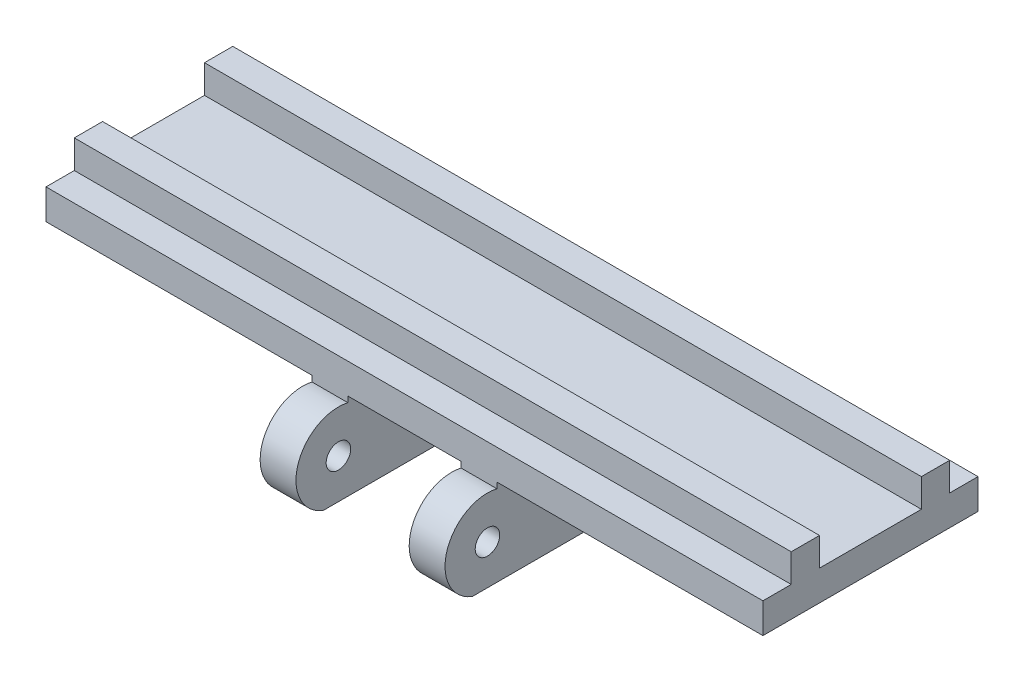
from build123d import *

# Parameters (mm, degrees)
SKETCH_1_W                = 38
SKETCH_1_H                = 11.4
EXTRUDE_1_DEPTH           = 1.6
SKETCH_1_4_W              = 4
SKETCH_1_4_H              = 14
EXTRUDE_2_DEPTH           = 5
SKETCH_2_W                = 0.1
SKETCH_2_H                = 1.3
SKETCH_2_W_2              = 10
SKETCH_2_W_3              = 2
CUT_EXTRUDE_1_DEPTH       = 21.856653615
CUT_EXTRUDE_START         = 7
CUT_EXTRUDE_2_DEPTH       = 2.1
CUT_EXTRUDE_START_2       = -4.9
CUT_EXTRUDE_3_DEPTH       = 2.1
CUT_EXTRUDE_6_DEPTH       = 21.856653615
CUT_EXTRUDE_6_DEPTH_BACK  = 21.856653615
EXTRUDE_START             = 5.1
SKETCH_4_6_R              = 2.25
EXTRUDE_3_DEPTH           = 1.9
EXTRUDE_START_2           = -7
SKETCH_4_7_R              = 2.25
EXTRUDE_4_DEPTH           = 1.9
CUT_EXTRUDE_7_DEPTH       = 22.386970332
CUT_EXTRUDE_7_DEPTH_BACK  = 22.386970332
SKETCH_3_R                = 0.65
SKETCH_3_R_2              = 0.55
CUT_EXTRUDE_START_3       = 3
CUT_EXTRUDE_8_DEPTH       = 2.1
CUT_EXTRUDE_START_4       = -5.1
SKETCH_5_2_R              = 2.5
SKETCH_5_2_W              = 2.5
SKETCH_5_2_H              = 2.5
CUT_EXTRUDE_9_DEPTH       = 5.1
CUT_EXTRUDE_10_DEPTH      = 22.386970332
CUT_EXTRUDE_10_DEPTH_BACK = 22.386970332
EXTRUDE_START_3           = 3
EXTRUDE_5_DEPTH           = 1.9
EXTRUDE_START_4           = -4.9
EXTRUDE_6_DEPTH           = 1.9
CUT_EXTRUDE_11_DEPTH      = 22.386970332
CUT_EXTRUDE_11_DEPTH_BACK = 22.386970332
SKETCH_3_3_R              = 0.65
SKETCH_3_3_R_2            = 0.55
CUT_EXTRUDE_12_DEPTH      = 22.386970332
CUT_EXTRUDE_12_DEPTH_BACK = 22.386970332
SKETCH_9_W                = 15.45
SKETCH_9_H                = 0.397025916
SKETCH_10_W               = 38
SKETCH_10_H               = 1.5
EXTRUDE_7_DEPTH           = 1.5
FILLET_1_R                = 1
SKETCH_11_W               = 4.7
SKETCH_11_H               = 4.602974084
CUT_EXTRUDE_13_DEPTH      = 17.397649411
CUT_EXTRUDE_START_5       = 4.9
SKETCH_11_2_W             = 4.7
SKETCH_11_2_H             = 4.602974084
CUT_EXTRUDE_14_DEPTH      = 17.397649411
CUT_EXTRUDE_START_6       = 5.1
SKETCH_11_4_W             = 4.7
SKETCH_11_4_H             = 4.602974084
CUT_EXTRUDE_15_DEPTH      = 10.2


# Read off the part's stored shape, not the designer's step: 切除-拉伸8, 凸台-拉伸5, 凸台-拉伸6
with BuildPart() as part:
    # 草图1 → 凸台-拉伸1 (new body)
    with BuildSketch(Plane(origin=(0, 0, 0), x_dir=(1, 0, 0), z_dir=(0, 1, 0))):
        Rectangle(SKETCH_1_W, SKETCH_1_H)
    extrude(amount=EXTRUDE_1_DEPTH)

    # 草图1<4> → 凸台-拉伸2 (add)
    with BuildSketch(Plane(origin=(0, 0, 0), x_dir=(1, 0, 0), z_dir=(0, 1, 0))):
        with Locations((-5, 0)):
            Rectangle(SKETCH_1_4_W, SKETCH_1_4_H)
        with Locations((5, 0)):
            Rectangle(SKETCH_1_4_W, SKETCH_1_4_H)
    extrude(amount=-EXTRUDE_2_DEPTH)

    # 草图2 → 切除-拉伸1 (cut, through all)
    with BuildSketch(Plane(origin=(0, 0, 0), x_dir=(1, 0, 0), z_dir=(0, 1, 0))):
        with Locations((-5.05, 6.35)):
            Rectangle(SKETCH_2_W, SKETCH_2_H)
        with Locations((0, 6.35)):
            Rectangle(SKETCH_2_W_2, SKETCH_2_H)
        with Locations((5.05, 6.35)):
            Rectangle(SKETCH_2_W, SKETCH_2_H)
        with Locations((-6, -6.35)):
            Rectangle(SKETCH_2_W_3, SKETCH_2_H)
        with Locations((-4.95, -6.35)):
            Rectangle(SKETCH_2_W, SKETCH_2_H)
        with Locations((4.95, -6.35)):
            Rectangle(SKETCH_2_W, SKETCH_2_H)
        with Locations((6, -6.35)):
            Rectangle(SKETCH_2_W_3, SKETCH_2_H)
    extrude(amount=-CUT_EXTRUDE_1_DEPTH, mode=Mode.SUBTRACT)

    # 草图4 → 切除-拉伸2 (cut)
    with BuildSketch(Plane(origin=(0, 0, 0), x_dir=(0, 0, -1), z_dir=(1, 0, 0)).offset(CUT_EXTRUDE_START)):
        with BuildLine():
            ThreePointArc((-3.7, -2.5), (-4.263508327, -0.91886117), (-5.7, -0.050510257))
            Line((-5.7, -0.050510257), (-5.7, -5))
            Line((-5.7, -5), (-3.7, -5))
            Line((-3.7, -5), (-3.7, -2.5))
        make_face()
    extrude(amount=-CUT_EXTRUDE_2_DEPTH, mode=Mode.SUBTRACT)

    # 草图4<3> → 切除-拉伸3 (cut)
    with BuildSketch(Plane(origin=(0, 0, 0), x_dir=(0, 0, -1), z_dir=(1, 0, 0)).offset(CUT_EXTRUDE_START_2)):
        with BuildLine():
            ThreePointArc((-3.7, -2.5), (-4.263508327, -0.91886117), (-5.7, -0.050510257))
            Line((-5.7, -0.050510257), (-5.7, -5))
            Line((-5.7, -5), (-3.7, -5))
            Line((-3.7, -5), (-3.7, -2.5))
        make_face()
    extrude(amount=-CUT_EXTRUDE_3_DEPTH, mode=Mode.SUBTRACT)

    # 草图4<5> → 切除-拉伸6 (cut, two sides: drawn at the far end of the back side and taken through both)
    with BuildSketch(Plane(origin=(0, 0, 0), x_dir=(0, 0, -1), z_dir=(1, 0, 0)).offset(-CUT_EXTRUDE_6_DEPTH_BACK)):
        with BuildLine():
            Line((8.45, 0), (5.7, 0))
            Line((5.7, 0), (5.7, -0.306258903))
            ThreePointArc((5.7, -0.306258903), (7.60312152, -0.74109409), (8.45, -2.5))
            Line((8.45, -2.5), (8.45, 0))
        make_face()
        with BuildLine():
            Line((8.45, -5), (8.45, -2.5))
            ThreePointArc((8.45, -2.5), (7.60312152, -4.25890591), (5.7, -4.693741097))
            Line((5.7, -4.693741097), (5.7, -5))
            Line((5.7, -5), (8.45, -5))
        make_face()
    extrude(amount=CUT_EXTRUDE_6_DEPTH + CUT_EXTRUDE_6_DEPTH_BACK, mode=Mode.SUBTRACT)

    # 草图4<6> → 凸台-拉伸3 (add)
    with BuildSketch(Plane(origin=(0, 0, 0), x_dir=(0, 0, -1), z_dir=(1, 0, 0)).offset(EXTRUDE_START)):
        with Locations((6.2, -2.5)):
            Circle(SKETCH_4_6_R)
    extrude(amount=EXTRUDE_3_DEPTH)

    # 草图4<7> → 凸台-拉伸4 (add)
    with BuildSketch(Plane(origin=(0, 0, 0), x_dir=(0, 0, -1), z_dir=(1, 0, 0)).offset(EXTRUDE_START_2)):
        with Locations((6.2, -2.5)):
            Circle(SKETCH_4_7_R)
    extrude(amount=EXTRUDE_4_DEPTH)

    # 草图3 → 切除-拉伸7 (cut, two sides: drawn at the far end of the back side and taken through both)
    with BuildSketch(Plane(origin=(0, 0, 0), x_dir=(0, 0, -1), z_dir=(1, 0, 0)).offset(-CUT_EXTRUDE_7_DEPTH_BACK)):
        with Locations(Location((-6.2, -2.5, 0), (0, 0, 180))):
            Circle(SKETCH_3_R)
        with Locations(Location((6.2, -2.5, 0), (0, 0, 204.619977329))):
            Circle(SKETCH_3_R_2)
    extrude(amount=CUT_EXTRUDE_7_DEPTH + CUT_EXTRUDE_7_DEPTH_BACK, mode=Mode.SUBTRACT)

    # 切除-拉伸8 outline → 切除-拉伸8 (cut)
    with BuildSketch(Plane(origin=(0, 0, 0), x_dir=(0, 0, -1), z_dir=(1, 0, 0)).offset(CUT_EXTRUDE_START_3)):
        with BuildLine():
            Line((3.7, -2.5), (3.7, -5))
            Line((3.7, -5), (5.7, -5))
            Line((5.7, -5), (5.7, -2.729128785))
            ThreePointArc((5.7, -2.729128785), (5.65, -2.5), (5.7, -2.270871215))
            Line((5.7, -2.270871215), (5.7, -0.050510257))
            ThreePointArc((5.7, -0.050510257), (4.263508327, -0.91886117), (3.7, -2.5))
        make_face()
    extrude(amount=CUT_EXTRUDE_8_DEPTH, mode=Mode.SUBTRACT)

    # 草图5<2> → 切除-拉伸9 (cut)
    with BuildSketch(Plane(origin=(0, 0, 0), x_dir=(0, 0, -1), z_dir=(1, 0, 0)).offset(CUT_EXTRUDE_START_4)):
        with Locations((6.2, -2.5)):
            Circle(SKETCH_5_2_R)
        with Locations((4.95, -3.75)):
            Rectangle(SKETCH_5_2_W, SKETCH_5_2_H)
    extrude(amount=CUT_EXTRUDE_9_DEPTH, mode=Mode.SUBTRACT)

    # 草图7 → 切除-拉伸10 (cut, two sides: drawn at the far end of the back side and taken through both)
    with BuildSketch(Plane(origin=(0, 0, 0), x_dir=(0, 0, -1), z_dir=(1, 0, 0)).offset(-CUT_EXTRUDE_10_DEPTH_BACK)):
        with BuildLine():
            Line((-5.7, -0.306258903), (-5.7, 0))
            Line((-5.7, 0), (-8.45, 0))
            Line((-8.45, 0), (-8.45, -2.5))
            ThreePointArc((-8.45, -2.5), (-7.60312152, -0.74109409), (-5.7, -0.306258903))
        make_face()
    extrude(amount=CUT_EXTRUDE_10_DEPTH + CUT_EXTRUDE_10_DEPTH_BACK, mode=Mode.SUBTRACT)

    # 凸台-拉伸5 outline → 凸台-拉伸5 (add)
    with BuildSketch(Plane(origin=(0, 0, 0), x_dir=(0, 0, -1), z_dir=(1, 0, 0)).offset(EXTRUDE_START_3)):
        with BuildLine():
            Line((-7, -4.602974084), (-7, -0.397025915))
            ThreePointArc((-7, -0.397025915), (-8.45, -2.5), (-7, -4.602974084))
        make_face()
        with BuildLine():
            ThreePointArc((-5.7, -2.084668807), (-6.85, -2.5), (-5.7, -2.915331193))
            Line((-5.7, -2.915331193), (-5.7, -2.084668807))
        make_face()
    extrude(amount=EXTRUDE_5_DEPTH)

    # 凸台-拉伸6 outline → 凸台-拉伸6 (add)
    with BuildSketch(Plane(origin=(0, 0, 0), x_dir=(0, 0, -1), z_dir=(1, 0, 0)).offset(EXTRUDE_START_4)):
        with BuildLine():
            Line((-7, -4.602974084), (-7, -0.397025915))
            ThreePointArc((-7, -0.397025915), (-8.45, -2.5), (-7, -4.602974084))
        make_face()
        with BuildLine():
            ThreePointArc((-5.7, -2.084668807), (-6.85, -2.5), (-5.7, -2.915331193))
            Line((-5.7, -2.915331193), (-5.7, -2.084668807))
        make_face()
    extrude(amount=EXTRUDE_6_DEPTH)

    # 草图3<3> → 切除-拉伸11 (cut, two sides: drawn at the far end of the back side and taken through both)
    with BuildSketch(Plane(origin=(0, 0, 0), x_dir=(0, 0, -1), z_dir=(1, 0, 0)).offset(-CUT_EXTRUDE_11_DEPTH_BACK)):
        with Locations(Location((-6.2, -2.5, 0), (0, 0, 180))):
            Circle(SKETCH_3_3_R)
        with Locations(Location((6.2, -2.5, 0), (0, 0, 180))):
            Circle(SKETCH_3_3_R_2)
    extrude(amount=CUT_EXTRUDE_11_DEPTH + CUT_EXTRUDE_11_DEPTH_BACK, mode=Mode.SUBTRACT)

    # 草图9 → 切除-拉伸12 (cut, two sides: drawn at the far end of the back side and taken through both)
    with BuildSketch(Plane(origin=(0, 0, 0), x_dir=(0, 0, -1), z_dir=(1, 0, 0)).offset(-CUT_EXTRUDE_12_DEPTH_BACK)):
        with Locations((0.725, -4.801487042)):
            Rectangle(SKETCH_9_W, SKETCH_9_H)
    extrude(amount=CUT_EXTRUDE_12_DEPTH + CUT_EXTRUDE_12_DEPTH_BACK, mode=Mode.SUBTRACT)

    # 草图10 → 凸台-拉伸7 (add)
    with BuildSketch(Plane(origin=(0, 1.6, 0), x_dir=(1, 0, 0), z_dir=(0, 1, 0))):
        with Locations((0, 3.45)):
            Rectangle(SKETCH_10_W, SKETCH_10_H)
        with Locations((0, -3.45)):
            Rectangle(SKETCH_10_W, SKETCH_10_H)
    extrude(amount=EXTRUDE_7_DEPTH)

    # 圆角1
    fillet_1_edges = [part.edges().sort_by_distance(p)[0] for p in [
        (5.95, -4.602974084, 3.7),
        (4.05, -4.602974084, -3.7),
        (-4.05, -4.602974084, -3.7),
        (-5.95, -4.602974084, 3.7),
    ]]
    fillet(fillet_1_edges, radius=FILLET_1_R)

    # 草图11 → 切除-拉伸13 (cut, through all)
    with BuildSketch(Plane(origin=(0, 0, 0), x_dir=(0, 0, -1), z_dir=(1, 0, 0)).offset(CUT_EXTRUDE_START_2)):
        with Locations((-3.35, -2.301487042)):
            Rectangle(SKETCH_11_W, SKETCH_11_H)
    extrude(amount=-CUT_EXTRUDE_13_DEPTH, mode=Mode.SUBTRACT)

    # 草图11<2> → 切除-拉伸14 (cut, through all)
    with BuildSketch(Plane(origin=(0, 0, 0), x_dir=(0, 0, -1), z_dir=(1, 0, 0)).offset(CUT_EXTRUDE_START_5)):
        with Locations((-3.35, -2.301487042)):
            Rectangle(SKETCH_11_2_W, SKETCH_11_2_H)
    extrude(amount=CUT_EXTRUDE_14_DEPTH, mode=Mode.SUBTRACT)

    # 草图11<4> → 切除-拉伸15 (cut)
    with BuildSketch(Plane(origin=(0, 0, 0), x_dir=(0, 0, -1), z_dir=(1, 0, 0)).offset(CUT_EXTRUDE_START_6)):
        with Locations((3.35, -2.301487042)):
            Rectangle(SKETCH_11_4_W, SKETCH_11_4_H)
    extrude(amount=-CUT_EXTRUDE_15_DEPTH, mode=Mode.SUBTRACT)


solid = part.part
